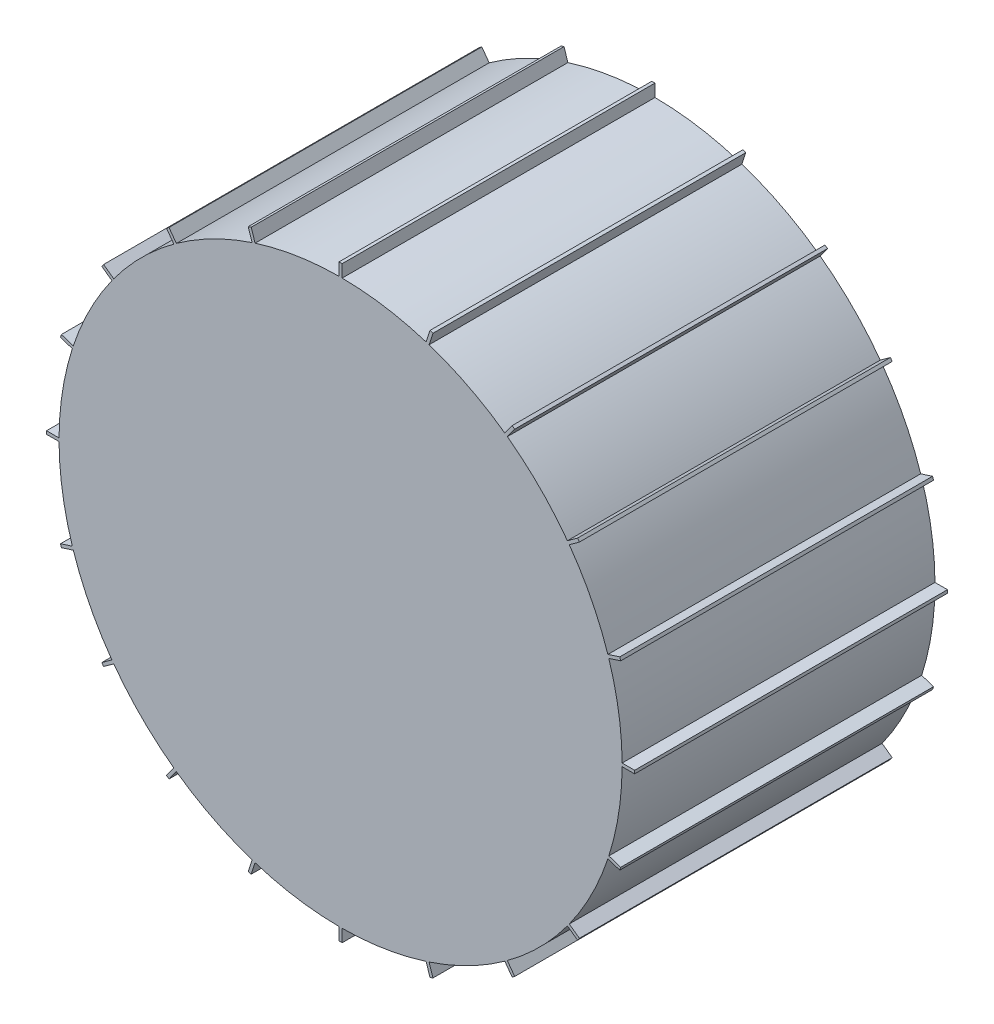
from build123d import *

# Parameters (mm, degrees)
SKETCH1_R        = 450
WHEEL_BASE_DEPTH = 500
SKETCH3_W        = 5
SKETCH3_H        = 500
GROUSER_DEPTH    = 470
GROUSERS_COUNT   = 20


with BuildPart() as part:
    # Sketch1 → Wheel Base (new body)
    with BuildSketch(Plane.XY):
        Circle(SKETCH1_R)
    extrude(amount=WHEEL_BASE_DEPTH)

    # Sketch3 → Grouser (add)
    with BuildSketch(Plane(origin=(0, 0, 0), x_dir=(1, 0, 0), z_dir=(0, 1, 0))):
        with Locations((0, -250)):
            Rectangle(SKETCH3_W, SKETCH3_H)
    grouser = extrude(amount=GROUSER_DEPTH)

    # Grousers: Grouser ×20 about axis
    grousers_axis = Axis((0, 0, 500), (0, 0, -1))
    for i in range(1, GROUSERS_COUNT):
        add(grouser.rotate(grousers_axis, i * 360 / GROUSERS_COUNT))


solid = part.part
